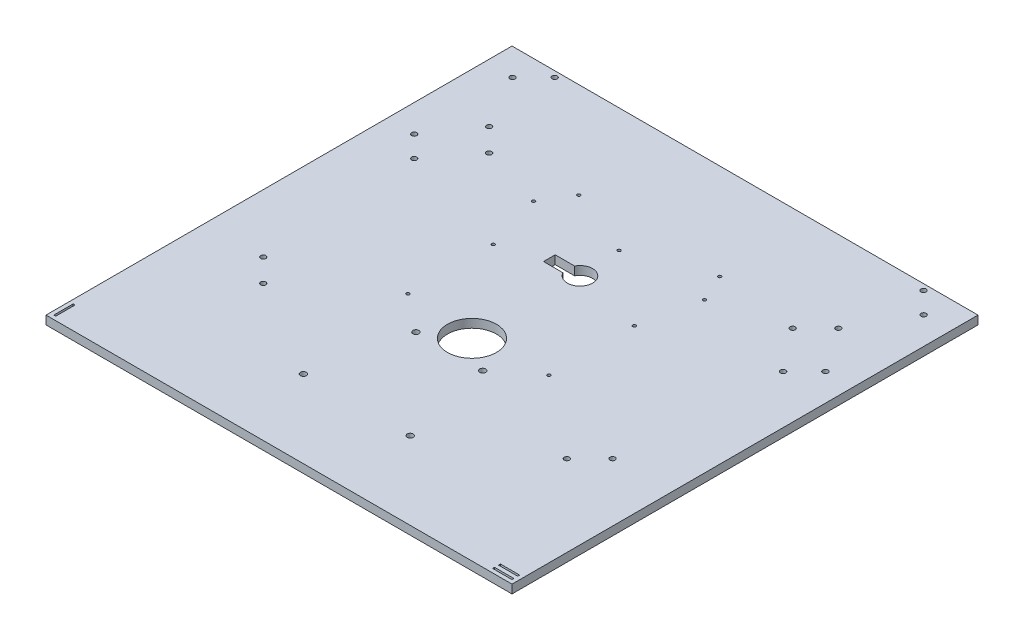
from build123d import *

# Parameters (mm, degrees)
SKETCH2_W           = 304.8
SKETCH2_H           = 304.8
BOSS_EXTRUDE1_DEPTH = 5.588
SKETCH4_W           = 1.27
SKETCH4_H           = 12.7
SKETCH4_W_2         = 12.7
SKETCH4_H_2         = 1.27
CUT_EXTRUDE1_DEPTH  = 432.088512656
SKETCH5_W           = 228.854
SKETCH5_H           = 12.954
CUT_EXTRUDE2_DEPTH  = 0.254
SKETCH6_R           = 16.002
SKETCH6_R_2         = 1.7
SKETCH6_R_3         = 1.96
CUT_EXTRUDE3_DEPTH  = 432.088512656
CUT_EXTRUDE4_DEPTH  = 432.088512656
SKETCH8_R           = 1.016
CUT_EXTRUDE5_DEPTH  = 432.088512656
SKETCH9_R           = 1.016
CUT_EXTRUDE6_DEPTH  = 432.088512656
BOSS_EXTRUDE3_REACH = 433.089
SKETCH10_W          = 236.011664121
SKETCH10_H          = 22.945578457


with BuildPart() as part:
    # Sketch2 → Boss-Extrude1 (new body)
    with BuildSketch(Plane(origin=(0, 0, 0), x_dir=(1, 0, 0), z_dir=(0, 1, 0))):
        with Locations((152.4, 152.4)):
            Rectangle(SKETCH2_W, SKETCH2_H)
    extrude(amount=BOSS_EXTRUDE1_DEPTH)

    # Sketch4 → Cut-Extrude1 (cut, through all)
    with BuildSketch(Plane(origin=(0, 5.588, 0), x_dir=(1, 0, 0), z_dir=(0, 1, 0))):
        with Locations((3.175, 8.89)):
            Rectangle(SKETCH4_W, SKETCH4_H)
        with Locations((295.91, 3.175)):
            Rectangle(SKETCH4_W_2, SKETCH4_H_2)
        with Locations((295.91, 6.985)):
            Rectangle(SKETCH4_W_2, SKETCH4_H_2)
    extrude(amount=-CUT_EXTRUDE1_DEPTH, mode=Mode.SUBTRACT)

    # Sketch5 → Cut-Extrude2 (cut)
    with BuildSketch(Plane(origin=(0, 5.588, 0), x_dir=(1, 0, 0), z_dir=(0, 1, 0))):
        with Locations((148.97354, 274.58924)):
            Rectangle(SKETCH5_W, SKETCH5_H)
    extrude(amount=-CUT_EXTRUDE2_DEPTH, mode=Mode.SUBTRACT)

    # Sketch6 → Cut-Extrude3 (cut, through all)
    with BuildSketch(Plane(origin=(0, 5.588, 0), x_dir=(1, 0, 0), z_dir=(0, 1, 0))):
        with Locations((152.4799846, 126.1262654)):
            Circle(SKETCH6_R)
        with Locations((31.75, 300.959562824)):
            Circle(SKETCH6_R_2)
        with Locations((17.93875, 287.148312824)):
            Circle(SKETCH6_R_2)
        with Locations((273.05, 300.959562824)):
            Circle(SKETCH6_R_2)
        with Locations((286.86125, 287.148312824)):
            Circle(SKETCH6_R_2)
        with Locations((286.86125, 222.906632824)):
            Circle(SKETCH6_R_2)
        with Locations((273.05, 209.095382824)):
            Circle(SKETCH6_R_2)
        with Locations((31.75, 209.095382824)):
            Circle(SKETCH6_R_2)
        with Locations((17.93875, 222.906632824)):
            Circle(SKETCH6_R_2)
        with Locations((38.1787654, 103.9330154)):
            Circle(SKETCH6_R_2)
        with Locations((53.1330154, 88.9787654)):
            Circle(SKETCH6_R_2)
        with Locations((251.6669846, 88.9787654)):
            Circle(SKETCH6_R_2)
        with Locations((266.6212346, 103.9330154)):
            Circle(SKETCH6_R_2)
        with Locations((266.6212346, 251.6669846)):
            Circle(SKETCH6_R_2)
        with Locations((251.6669846, 236.7127346)):
            Circle(SKETCH6_R_2)
        with Locations((53.1330154, 236.7127346)):
            Circle(SKETCH6_R_2)
        with Locations((38.1787654, 251.6669846)):
            Circle(SKETCH6_R_2)
        with Locations((130.6518596, 111.328047494)):
            Circle(SKETCH6_R_3)
        with Locations((174.3081096, 111.328047494)):
            Circle(SKETCH6_R_3)
        with Locations((187.4049846, 50.821596477)):
            Circle(SKETCH6_R_3)
        with Locations((117.5549846, 50.821596477)):
            Circle(SKETCH6_R_3)
    extrude(amount=-CUT_EXTRUDE3_DEPTH, mode=Mode.SUBTRACT)

    # Sketch7 → Cut-Extrude4 (cut, through all)
    with BuildSketch(Plane(origin=(0, 5.588, 0), x_dir=(1, 0, 0), z_dir=(0, 1, 0))):
        with BuildLine():
            Line((145.076822752, 200.66), (132.376822752, 200.66))
            Line((132.376822752, 200.66), (132.376822752, 193.04))
            Line((132.376822752, 193.04), (145.076822752, 193.04))
            ThreePointArc((145.076822752, 193.04), (160.655, 196.85), (145.076822752, 200.66))
        make_face()
    extrude(amount=-CUT_EXTRUDE4_DEPTH, mode=Mode.SUBTRACT)

    # Sketch8 → Cut-Extrude5 (cut, through all)
    with BuildSketch(Plane(origin=(0, 5.588, 0), x_dir=(1, 0, 0), z_dir=(0, 1, 0))):
        with Locations((206.6999846, 223.9950154)):
            Circle(SKETCH8_R)
        with Locations((150.8199846, 223.9950154)):
            Circle(SKETCH8_R)
        with Locations((94.9399846, 223.9950154)):
            Circle(SKETCH8_R)
    extrude(amount=-CUT_EXTRUDE5_DEPTH, mode=Mode.SUBTRACT)

    # Sketch9 → Cut-Extrude6 (cut, through all)
    with BuildSketch(Plane(origin=(0, 5.588, 0), x_dir=(1, 0, 0), z_dir=(0, 1, 0))):
        with Locations((106.3, 242.18)):
            Circle(SKETCH9_R)
        with Locations((106.3, 186.3)):
            Circle(SKETCH9_R)
        with Locations((106.3, 130.42)):
            Circle(SKETCH9_R)
        with Locations((198.5, 130.42)):
            Circle(SKETCH9_R)
        with Locations((198.5, 186.3)):
            Circle(SKETCH9_R)
        with Locations((198.5, 242.18)):
            Circle(SKETCH9_R)
    extrude(amount=-CUT_EXTRUDE6_DEPTH, mode=Mode.SUBTRACT)

    # Sketch10 → Boss-Extrude3 (add, up to next)
    with BuildSketch(Plane(origin=(0, 5.588, 0), x_dir=(1, 0, 0), z_dir=(0, 1, 0)), mode=Mode.PRIVATE) as boss_extrude3_sk1:
        with Locations((148.069627159, 275.695978824)):
            Rectangle(SKETCH10_W, SKETCH10_H)
    boss_extrude3_tool1 = extrude(boss_extrude3_sk1.sketch, amount=-BOSS_EXTRUDE3_REACH, mode=Mode.PRIVATE) - part.part
    add(boss_extrude3_tool1.solids().sort_by_distance((148.069627, 5.588, -275.695979))[0])


solid = part.part
